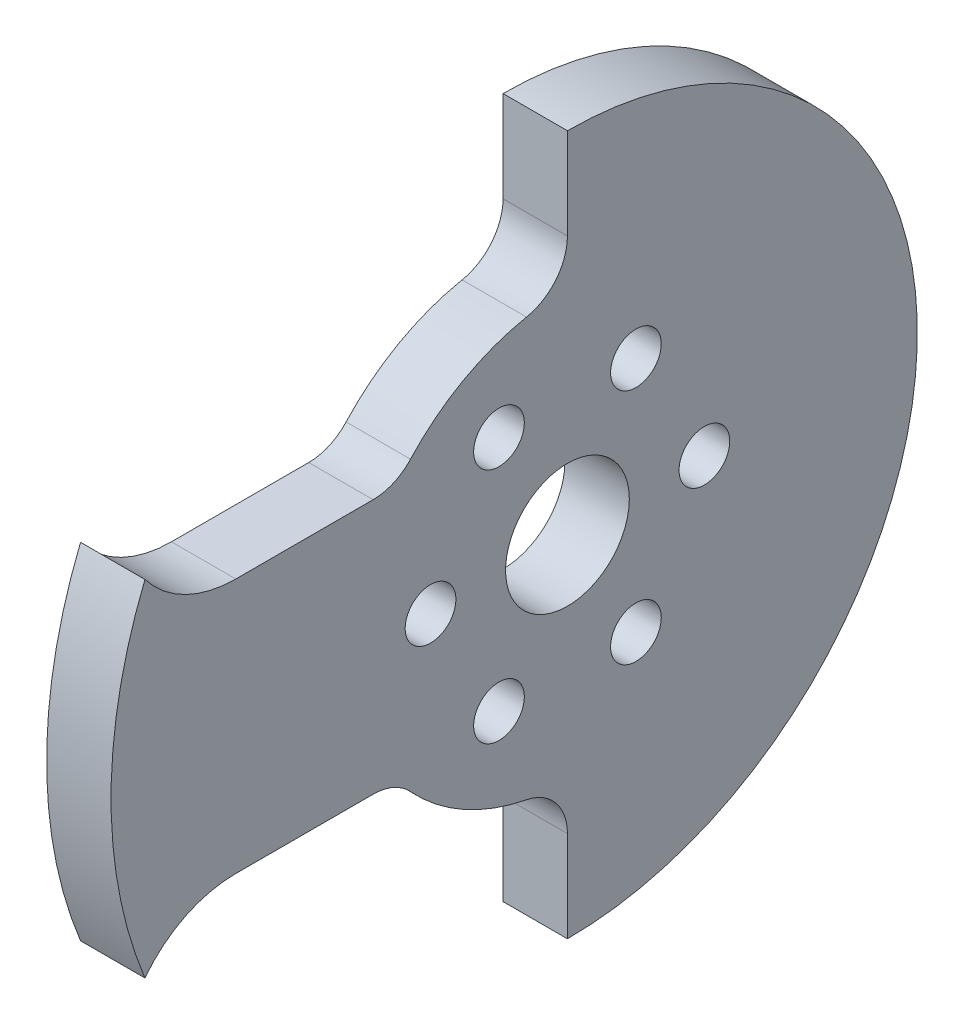
from build123d import *

# Parameters (mm, degrees)
BOSS_EXTRUDE1_DEPTH      = 3.175
BOSS_EXTRUDE1_DEPTH_BACK = 3.175
SKETCH1_R                = 6.1
SKETCH1_R_2              = 2.5


with BuildPart() as part:
    # Sketch1 → Boss-Extrude1 (new, two sides: drawn at the far end of the back side and taken through both)
    with BuildSketch(Plane(origin=(0, 0, 0), x_dir=(0, 0, -1), z_dir=(1, 0, 0)).offset(-BOSS_EXTRUDE1_DEPTH_BACK)):
        with BuildLine():
            Line((-0.089909589, 64.015198307), (-0.028642334, 63.936164622))
            ThreePointArc((-0.028642334, 63.936164622), (3.915206527, 60.723907078), (8.870259996, 59.575))
            Line((8.870259996, 59.575), (22.408859912, 59.575))
            ThreePointArc((22.408859912, 59.575), (24.421440536, 59.997935523), (26.093544426, 61.195192308))
            ThreePointArc((26.093544426, 61.195192308), (31.298800841, 65.317164164), (37.530757843, 67.608028251))
            ThreePointArc((37.530757843, 67.608028251), (40.429769362, 69.337257098), (41.569219382, 72.514701644))
            Line((41.569219382, 72.514701644), (41.569219382, 81.5))
            ThreePointArc((41.569219382, 81.5), (76.069219382, 47), (41.569219382, 12.5))
            Line((41.569219382, 12.5), (41.569219382, 21.485298356))
            ThreePointArc((41.569219382, 21.485298356), (40.429769362, 24.662742902), (37.530757843, 26.391971749))
            ThreePointArc((37.530757843, 26.391971749), (31.298800841, 28.682835836), (26.093544426, 32.804807692))
            ThreePointArc((26.093544426, 32.804807692), (24.421440536, 34.002064477), (22.408859912, 34.425))
            Line((22.408859912, 34.425), (8.870259996, 34.425))
            ThreePointArc((8.870259996, 34.425), (3.915206527, 33.276092922), (-0.028642334, 30.063835378))
            Line((-0.028642334, 30.063835378), (-0.089909589, 29.984801693))
            ThreePointArc((-0.089909589, 29.984801693), (-3.430780618, 47), (-0.089909589, 64.015198307))
        make_face()
        with Locations((41.569219382, 47)):
            Circle(SKETCH1_R, mode=Mode.SUBTRACT)
        with Locations((48.319219382, 58.691342951)):
            Circle(SKETCH1_R_2, mode=Mode.SUBTRACT)
        with Locations((34.819219382, 58.691342951)):
            Circle(SKETCH1_R_2, mode=Mode.SUBTRACT)
        with Locations((28.069219382, 47)):
            Circle(SKETCH1_R_2, mode=Mode.SUBTRACT)
        with Locations((34.819219382, 35.308657049)):
            Circle(SKETCH1_R_2, mode=Mode.SUBTRACT)
        with Locations((48.319219382, 35.308657049)):
            Circle(SKETCH1_R_2, mode=Mode.SUBTRACT)
        with Locations((55.069219382, 47)):
            Circle(SKETCH1_R_2, mode=Mode.SUBTRACT)
    extrude(amount=BOSS_EXTRUDE1_DEPTH + BOSS_EXTRUDE1_DEPTH_BACK)


solid = part.part
